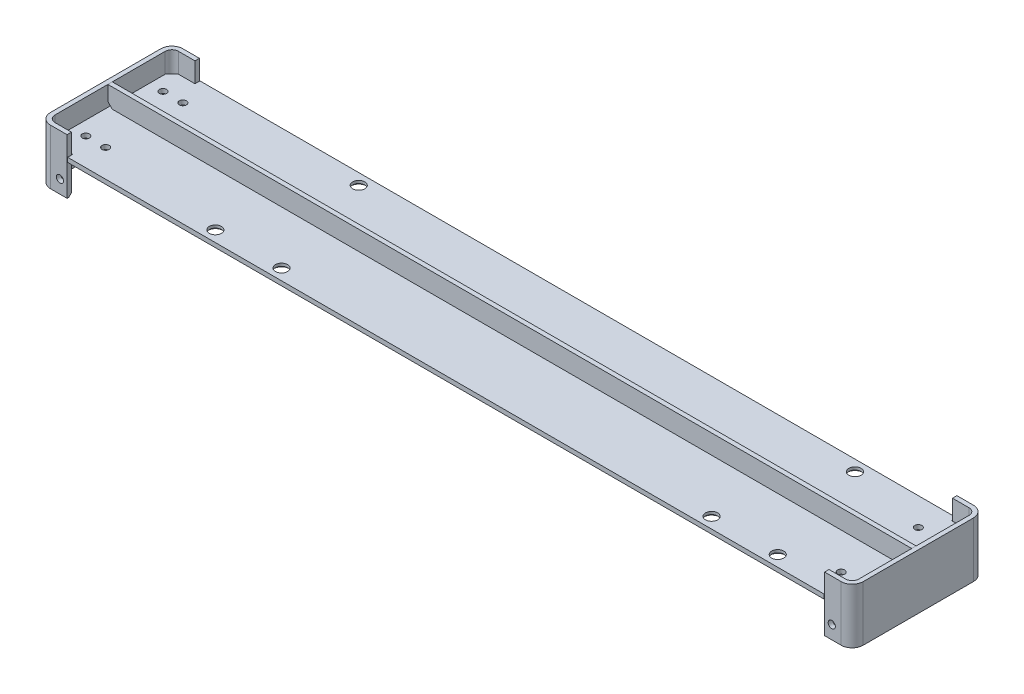
from build123d import *

# Parameters (mm, degrees)
MEMBER_1_DEPTH                   = 50
MEMBER_2_DEPTH                   = 50
EXTRUDE_START                    = 28.5
EXTRUDE_1_DEPTH                  = 4
EXTRUDE_2_DEPTH                  = 2
HOLE_WIZARD_11_0_11_1_AT_2_COUNT = 2
HOLE_WIZARD_11_0_11_1_AT_2_PITCH = 60
HOLE_WIZARD_11_0_11_1_AT_3_COUNT = 2
HOLE_WIZARD_11_0_11_1_AT_3_PITCH = 104.403065089
HOLE_WIZARD_11_0_11_1_AT_4_COUNT = 2
HOLE_WIZARD_11_0_11_1_AT_4_PITCH = 450
HOLE_WIZARD_11_0_11_1_AT_5_COUNT = 2
HOLE_WIZARD_11_0_11_1_AT_5_PITCH = 490.306026885
HOLE_WIZARD_11_0_11_1_AT_6_COUNT = 2
HOLE_WIZARD_11_0_11_1_AT_6_PITCH = 510
SKETCH_9_R                       = 3.25
CUT_EXTRUDE_3_DEPTH              = 391.758557168
SKETCH_10_R                      = 3.25
CUT_EXTRUDE_4_DEPTH              = 4
CHAMFER_1_SIZE                   = 2.5
CHAMFER_2_SIZE                   = 2.5


# Read off the part's stored shape, not the designer's step: Конструкция1, Конструкция2
with BuildPart() as part:
    # Member 1 outline → Member 1 (new body)
    with BuildSketch(Plane(origin=(0, 0, 0), x_dir=(1, 0, 0), z_dir=(0, 1, 0))):
        with BuildLine():
            ThreePointArc((-358.5, -56), (-362.742640687, -54.242640687), (-364.5, -50))
            Line((-364.5, -50), (-364.5, 50))
            ThreePointArc((-364.5, 50), (-362.742640687, 54.242640687), (-358.5, 56))
            Line((-358.5, 56), (-343.5, 56))
            Line((-343.5, 56), (-343.5, 60))
            Line((-343.5, 60), (-358.5, 60))
            ThreePointArc((-358.5, 60), (-365.571067812, 57.071067812), (-368.5, 50))
            Line((-368.5, 50), (-368.5, -50))
            ThreePointArc((-368.5, -50), (-365.571067812, -57.071067812), (-358.5, -60))
            Line((-358.5, -60), (-343.5, -60))
            Line((-343.5, -60), (-343.5, -56))
            Line((-343.5, -56), (-358.5, -56))
        make_face()
    extrude(amount=MEMBER_1_DEPTH)


with BuildPart() as body_2:
    # Member 2 outline → Member 2 (new body)
    with BuildSketch(Plane(origin=(0, 0, 0), x_dir=(1, 0, 0), z_dir=(0, 1, 0))):
        with BuildLine():
            ThreePointArc((364.5, -50), (362.742640687, -54.242640687), (358.5, -56))
            Line((358.5, -56), (343.5, -56))
            Line((343.5, -56), (343.5, -60))
            Line((343.5, -60), (358.5, -60))
            ThreePointArc((358.5, -60), (365.571067812, -57.071067812), (368.5, -50))
            Line((368.5, -50), (368.5, 50))
            ThreePointArc((368.5, 50), (365.571067812, 57.071067812), (358.5, 60))
            Line((358.5, 60), (343.5, 60))
            Line((343.5, 60), (343.5, 56))
            Line((343.5, 56), (358.5, 56))
            ThreePointArc((358.5, 56), (362.742640687, 54.242640687), (364.5, 50))
            Line((364.5, 50), (364.5, -50))
        make_face()
    extrude(amount=MEMBER_2_DEPTH)


with BuildPart() as body_3:
    # Эскиз5 → Вытянуть1 (new body)
    with BuildSketch(Plane(origin=(0, 0, 0), x_dir=(1, 0, 0), z_dir=(0, 1, 0)).offset(EXTRUDE_START)):
        Polygon((-343, -55.5), (-343, -60), (-46.097722286, -60), (46.097722286, -60), (343, -60), (343, -55.5), (358, -55.5), (364, -49.5), (364, 49.5), (358, 55.5), (343, 55.5), (343, 60), (-343, 60), (-343, 55.5), (-358, 55.5), (-364, 49.5), (-364, -49.5), (-358, -55.5), align=None)
    extrude(amount=EXTRUDE_1_DEPTH)

    # Эскиз8 → Диаметр отверстия Ø11.0 (11)1 (revolve, cut)
    with BuildSketch(Plane(origin=(-219, 28.5, 50), x_dir=(0, 0, -1), z_dir=(1, 0, 0))):
        Polygon((0, 0), (0, 21.5), (5.5, 21.5), (5.5, 1.5), (7, 0), align=None)
    hole_wizard_11_0_11_1 = revolve(axis=Axis((-219, 22.15, 50), (0, 1, 0)), mode=Mode.SUBTRACT)

    # Диаметр отверстия Ø11.0 (11)1 at 2: Диаметр отверстия Ø11.0 (11)1 ×2
    with Locations(*[(i * HOLE_WIZARD_11_0_11_1_AT_2_PITCH, 0, 0) for i in range(1, HOLE_WIZARD_11_0_11_1_AT_2_COUNT)]):
        add(hole_wizard_11_0_11_1, mode=Mode.SUBTRACT)

    # Диаметр отверстия Ø11.0 (11)1 at 3: Диаметр отверстия Ø11.0 (11)1 ×2
    with Locations(*[Vector(0.28734788556634566, 0, -0.9578262852211513) * (i * HOLE_WIZARD_11_0_11_1_AT_3_PITCH) for i in range(1, HOLE_WIZARD_11_0_11_1_AT_3_COUNT)]):
        add(hole_wizard_11_0_11_1, mode=Mode.SUBTRACT)

    # Диаметр отверстия Ø11.0 (11)1 at 4: Диаметр отверстия Ø11.0 (11)1 ×2
    with Locations(*[(i * HOLE_WIZARD_11_0_11_1_AT_4_PITCH, 0, 0) for i in range(1, HOLE_WIZARD_11_0_11_1_AT_4_COUNT)]):
        add(hole_wizard_11_0_11_1, mode=Mode.SUBTRACT)

    # Диаметр отверстия Ø11.0 (11)1 at 5: Диаметр отверстия Ø11.0 (11)1 ×2
    with Locations(*[Vector(0.9789804197376051, 0, -0.20395425411200097) * (i * HOLE_WIZARD_11_0_11_1_AT_5_PITCH) for i in range(1, HOLE_WIZARD_11_0_11_1_AT_5_COUNT)]):
        add(hole_wizard_11_0_11_1, mode=Mode.SUBTRACT)

    # Диаметр отверстия Ø11.0 (11)1 at 6: Диаметр отверстия Ø11.0 (11)1 ×2
    with Locations(*[(i * HOLE_WIZARD_11_0_11_1_AT_6_PITCH, 0, 0) for i in range(1, HOLE_WIZARD_11_0_11_1_AT_6_COUNT)]):
        add(hole_wizard_11_0_11_1, mode=Mode.SUBTRACT)

    # Эскиз10 → Вытянуть4 (cut)
    with BuildSketch(Plane(origin=(0, 32.5, 0), x_dir=(1, 0, 0), z_dir=(0, 1, 0))):
        with Locations(Location((-351.5, -35, 0), (0, 0, 270))):
            Circle(SKETCH_10_R)
        with Locations(Location((-333.5, -35, 0), (0, 0, 270))):
            Circle(SKETCH_10_R)
        with Locations(Location((-351.5, 35, 0), (0, 0, 270))):
            Circle(SKETCH_10_R)
        with Locations(Location((-333.5, 35, 0), (0, 0, 270))):
            Circle(SKETCH_10_R)
        with Locations(Location((333.5, 35, 0), (0, 0, 270))):
            Circle(SKETCH_10_R)
        with Locations(Location((351.5, 35, 0), (0, 0, 270))):
            Circle(SKETCH_10_R)
        with Locations(Location((333.5, -35, 0), (0, 0, 270))):
            Circle(SKETCH_10_R)
        with Locations(Location((351.5, -35, 0), (0, 0, 270))):
            Circle(SKETCH_10_R)
    extrude(amount=-CUT_EXTRUDE_4_DEPTH, mode=Mode.SUBTRACT)


with BuildPart() as body_4:
    # Эскиз6 → Вытянуть2 (new, symmetric)
    with BuildSketch(Plane.XY):
        Polygon((364.5, 50), (364.5, 36.5), (360.5, 32.5), (-360.5, 32.5), (-364.5, 36.5), (-364.5, 50), align=None)
    extrude(amount=EXTRUDE_2_DEPTH, both=True)


with BuildPart() as cut_extrude_3_tool:
    # Эскиз9 → Вытянуть3 (new, through all)
    with BuildSketch(Plane.XY.offset(60)):
        with Locations((-350, 12)):
            Circle(SKETCH_9_R)
        with Locations(Location((350, 12, 0), (0, 0, 180))):
            Circle(SKETCH_9_R)
    extrude(amount=-CUT_EXTRUDE_3_DEPTH)


with BuildPart() as part_1:
    add(part.part)

    # Вытянуть3: cut by cut_extrude_3_tool
    add(cut_extrude_3_tool.part, mode=Mode.SUBTRACT)

    # Фаска1
    # the kernel refuses this chamfer: 2.5 mm, written as the material it takes off along each edge
    with BuildSketch(Plane(origin=(-358.5, 0, -56), x_dir=(0, -0.027495876610586334, -0.9996219169112968), z_dir=(1, 0, 0))) as chamfer_1_piece_1:
        Polygon((CHAMFER_1_SIZE * 0.999621916911, CHAMFER_1_SIZE * 0.0274958766106), (-CHAMFER_1_SIZE * 0.0274958766106, CHAMFER_1_SIZE * 0.999621916911), (0, 0), align=None)
    extrude(amount=21.42920747, mode=Mode.SUBTRACT)
    with BuildSketch(Plane(origin=(-358.5, 0, -50), x_dir=(-0.478399584580855, 0, 0.8781422649393805), z_dir=(0.8781422649393805, 0, 0.478399584580855))) as chamfer_1_piece_2:
        Polygon((6 + CHAMFER_1_SIZE, 0), (6, -CHAMFER_1_SIZE), (6, 0), align=None)
    revolve(axis=Axis((-358.5, 0, -50), (0, -1, 0)), revolution_arc=151.419071563, mode=Mode.SUBTRACT)
    with BuildSketch(Plane(origin=(-358.5, 0, 50), x_dir=(-6.788051601834064e-11, 0, 1.0), z_dir=(1.0, 0, 6.788051601834064e-11))) as chamfer_1_piece_3:
        Polygon((6, -CHAMFER_1_SIZE), (6 + CHAMFER_1_SIZE, 0), (6, 0), align=None)
    revolve(axis=Axis((-358.5, 0, 50), (0, -1, 0)), revolution_arc=151.419071563, mode=Mode.SUBTRACT)
    with BuildSketch(Plane(origin=(-337.07079253, 0, 56), x_dir=(0, 0.9996219169112968, -0.0274958766105877), z_dir=(-1, 0, 0))) as chamfer_1_piece_4:
        Polygon((CHAMFER_1_SIZE * 0.999621916911, -CHAMFER_1_SIZE * 0.0274958766106), (-CHAMFER_1_SIZE * 0.0274958766106, -CHAMFER_1_SIZE * 0.999621916911), (0, 0), align=None)
    extrude(amount=21.42920747, mode=Mode.SUBTRACT)


with BuildPart() as body_2_1:
    add(body_2.part)

    # Вытянуть3: cut by cut_extrude_3_tool
    add(cut_extrude_3_tool.part, mode=Mode.SUBTRACT)

    # Фаска2
    # the kernel refuses this chamfer: 2.5 mm, written as the material it takes off along each edge
    with BuildSketch(Plane(origin=(337.07079253, 0, -56), x_dir=(0, -0.027495876610586334, -0.9996219169112968), z_dir=(1, 0, 0))) as chamfer_2_piece_1:
        Polygon((CHAMFER_2_SIZE * 0.999621916911, CHAMFER_2_SIZE * 0.0274958766106), (-CHAMFER_2_SIZE * 0.0274958766106, CHAMFER_2_SIZE * 0.999621916911), (0, 0), align=None)
    extrude(amount=21.42920747, mode=Mode.SUBTRACT)
    with BuildSketch(Plane(origin=(358.5, 0, -50), x_dir=(6.788051601834064e-11, 0, -1.0), z_dir=(-1.0, 0, -6.788051601834064e-11))) as chamfer_2_piece_2:
        Polygon((6 + CHAMFER_2_SIZE, 0), (6, -CHAMFER_2_SIZE), (6, 0), align=None)
    revolve(axis=Axis((358.5, 0, -50), (0, -1, 0)), revolution_arc=151.419071563, mode=Mode.SUBTRACT)
    with BuildSketch(Plane(origin=(358.5, 0, 50), x_dir=(0.478399584580855, 0, -0.8781422649393805), z_dir=(-0.8781422649393805, 0, -0.478399584580855))) as chamfer_2_piece_3:
        Polygon((6, -CHAMFER_2_SIZE), (6 + CHAMFER_2_SIZE, 0), (6, 0), align=None)
    revolve(axis=Axis((358.5, 0, 50), (0, -1, 0)), revolution_arc=151.419071563, mode=Mode.SUBTRACT)
    with BuildSketch(Plane(origin=(358.5, 0, 56), x_dir=(0, 0.9996219169112968, -0.0274958766105877), z_dir=(-1, 0, 0))) as chamfer_2_piece_4:
        Polygon((CHAMFER_2_SIZE * 0.999621916911, -CHAMFER_2_SIZE * 0.0274958766106), (-CHAMFER_2_SIZE * 0.0274958766106, -CHAMFER_2_SIZE * 0.999621916911), (0, 0), align=None)
    extrude(amount=21.42920747, mode=Mode.SUBTRACT)


solid = Compound([body_3.part, body_4.part, part_1.part, body_2_1.part])
